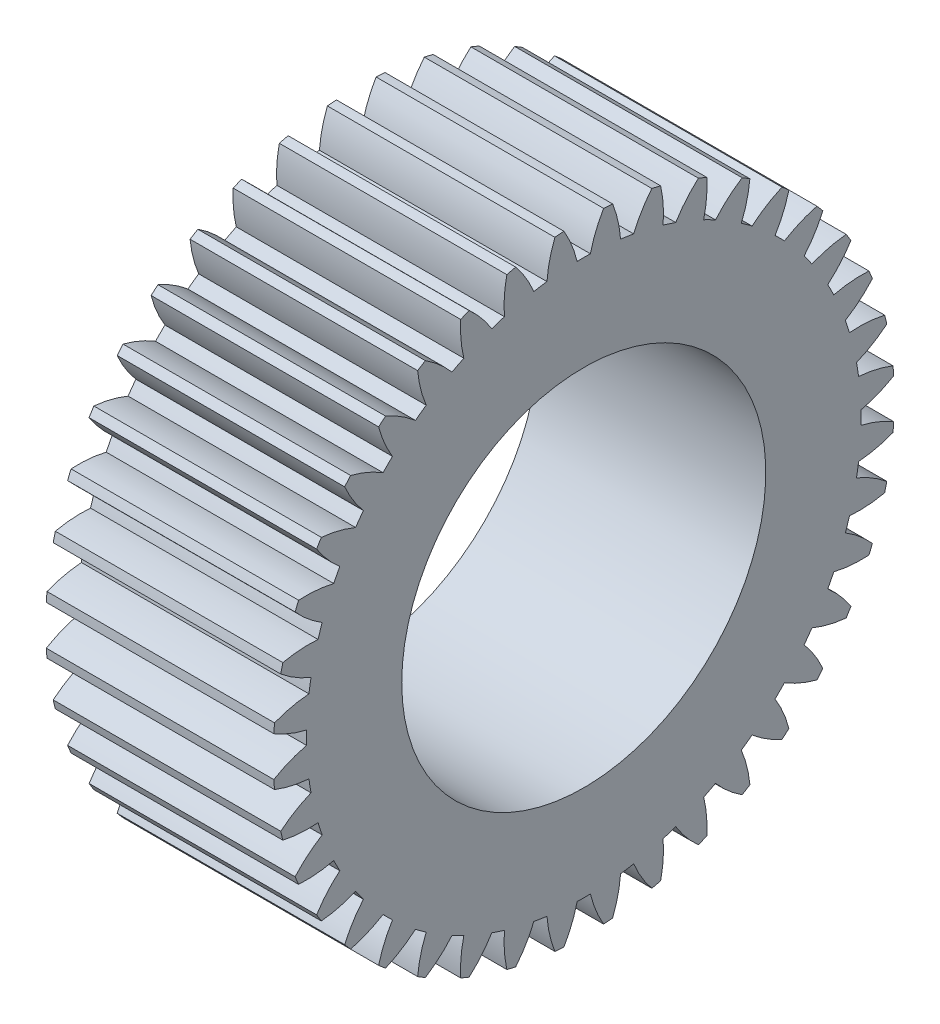
from build123d import *

# Parameters (mm, degrees)
BASPROSKE_W     = 10
BASPROSKE_H     = 13.65
TOOTHCUT_DEPTH  = 22.74040018
TEETHCUTS_COUNT = 40
TEETHCUTS_ANGLE = 351
BORSKE_R        = 8
BORE_DEPTH      = 50.0000508


with BuildPart() as part:
    # BasProSke → Base-Revolve (revolve)
    with BuildSketch(Plane(origin=(0, 0, 0), x_dir=(1, 0, 0), z_dir=(0, 1, 0))):
        with Locations((5, 6.825)):
            Rectangle(BASPROSKE_W, BASPROSKE_H)
    revolve(axis=Axis((-10, 0, 0), (1, 0, 0)))

    # TooCutSke → ToothCut (cut, through all)
    with BuildSketch(Plane(origin=(0, 0, 0), x_dir=(0, 0, -1), z_dir=(1, 0, 0))):
        with BuildLine():
            ThreePointArc((0.292047278, 12.183000067), (0, 12.1865), (-0.292047278, 12.183000067))
            ThreePointArc((-0.292047278, 12.183000067), (-0.533242423, 12.937521472), (-0.886244131, 13.646652941))
            ThreePointArc((-0.886244131, 13.646652941), (0, 13.6754), (0.886244131, 13.646652941))
            ThreePointArc((0.886244131, 13.646652941), (0.533242423, 12.937521472), (0.292047278, 12.183000067))
        make_face()
    toothcut = extrude(amount=TOOTHCUT_DEPTH, mode=Mode.SUBTRACT)

    # TeethCuts: ToothCut ×40 about axis
    teethcuts_axis = Axis((-10, 0, 0), (1, 0, 0))
    for i in range(1, TEETHCUTS_COUNT):
        add(toothcut.rotate(teethcuts_axis, i * TEETHCUTS_ANGLE / (TEETHCUTS_COUNT - 1)), mode=Mode.SUBTRACT)

    # BorSke → Bore (cut, symmetric)
    with BuildSketch(Plane(origin=(0, 0, 0), x_dir=(0, 0, -1), z_dir=(1, 0, 0))):
        Circle(BORSKE_R)
    extrude(amount=BORE_DEPTH, both=True, mode=Mode.SUBTRACT)


solid = part.part
